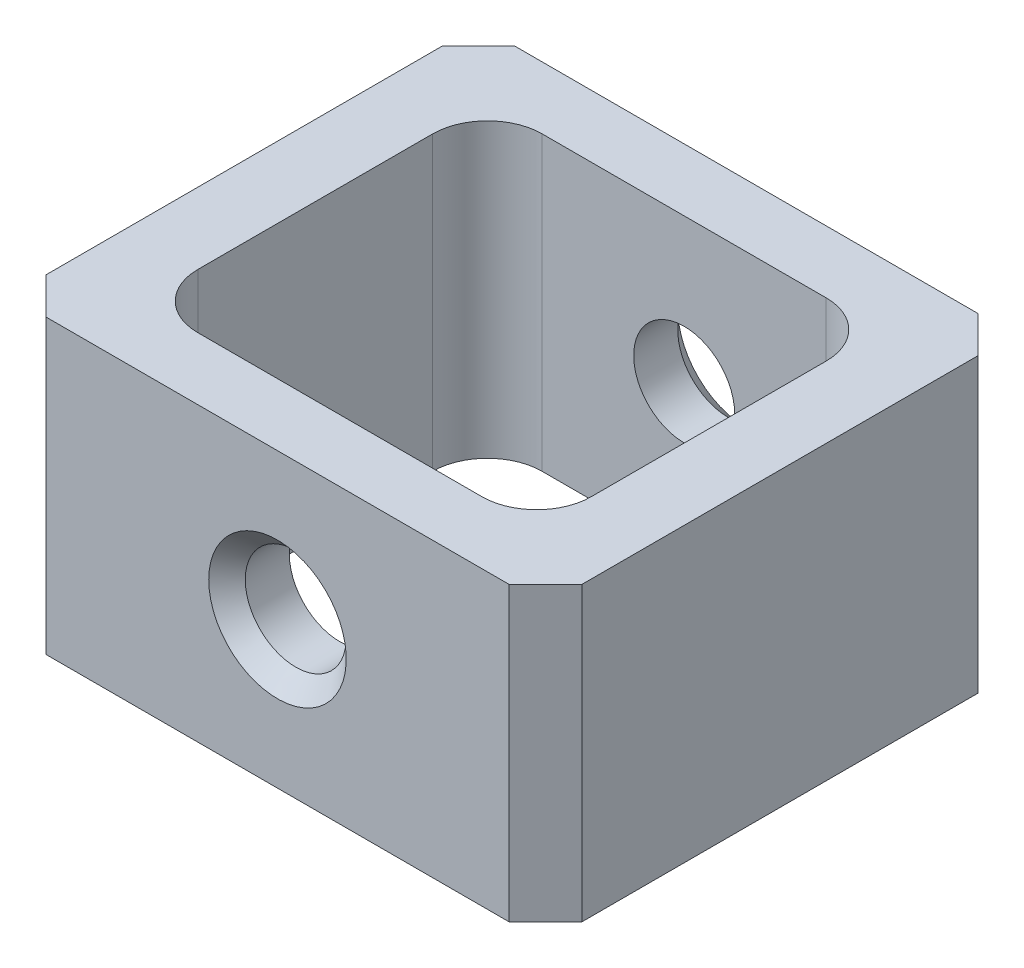
from build123d import *

# Parameters (mm, degrees)
BOSS_EXTRUDE1_DEPTH = 80
SKETCH2_R           = 13.819238445
CUT_EXTRUDE1_DEPTH  = 169.120402389
CHAMFER1_SIZE       = 5


with BuildPart() as part:
    # Sketch1 → Boss-Extrude1 (new body)
    with BuildSketch(Plane(origin=(0, 0, 0), x_dir=(1, 0, 0), z_dir=(0, 1, 0))):
        Polygon((73.362274437, 54.191990133), (63.362274437, 64.191990133), (-63.362274437, 64.191990133), (-73.362274437, 54.191990133), (-73.362274437, -54.191990133), (-63.362274437, -64.191990133), (63.362274437, -64.191990133), (73.362274437, -54.191990133), align=None)
        with BuildLine():
            Line((38.858513424, -47.126199246), (-38.858513424, -47.126199246))
            ThreePointArc((-38.858513424, -47.126199246), (-49.465115141, -42.732800964), (-53.858513424, -32.126199246))
            Line((-53.858513424, -32.126199246), (-53.858513424, 32.126199246))
            ThreePointArc((-53.858513424, 32.126199246), (-49.465115141, 42.732800964), (-38.858513424, 47.126199246))
            Line((-38.858513424, 47.126199246), (38.858513424, 47.126199246))
            ThreePointArc((38.858513424, 47.126199246), (49.465115141, 42.732800964), (53.858513424, 32.126199246))
            Line((53.858513424, 32.126199246), (53.858513424, -32.126199246))
            ThreePointArc((53.858513424, -32.126199246), (49.465115141, -42.732800964), (38.858513424, -47.126199246))
        make_face(mode=Mode.SUBTRACT)
    extrude(amount=BOSS_EXTRUDE1_DEPTH)

    # Sketch2 → Cut-Extrude1 (cut, through all)
    with BuildSketch(Plane(origin=(0, 0, -64.191990133), x_dir=(1, 0, 0), z_dir=(0, 0, -1))):
        with Locations((0, -40)):
            Circle(SKETCH2_R)
    extrude(amount=-CUT_EXTRUDE1_DEPTH, mode=Mode.SUBTRACT)

    # Chamfer1
    chamfer1_edges = [part.edges().sort_by_distance(p)[0] for p in [
        (-13.819238445, 40, 64.191990133),
        (-13.819238445, 40, -64.191990133),
    ]]
    chamfer(chamfer1_edges, length=CHAMFER1_SIZE)


solid = part.part
